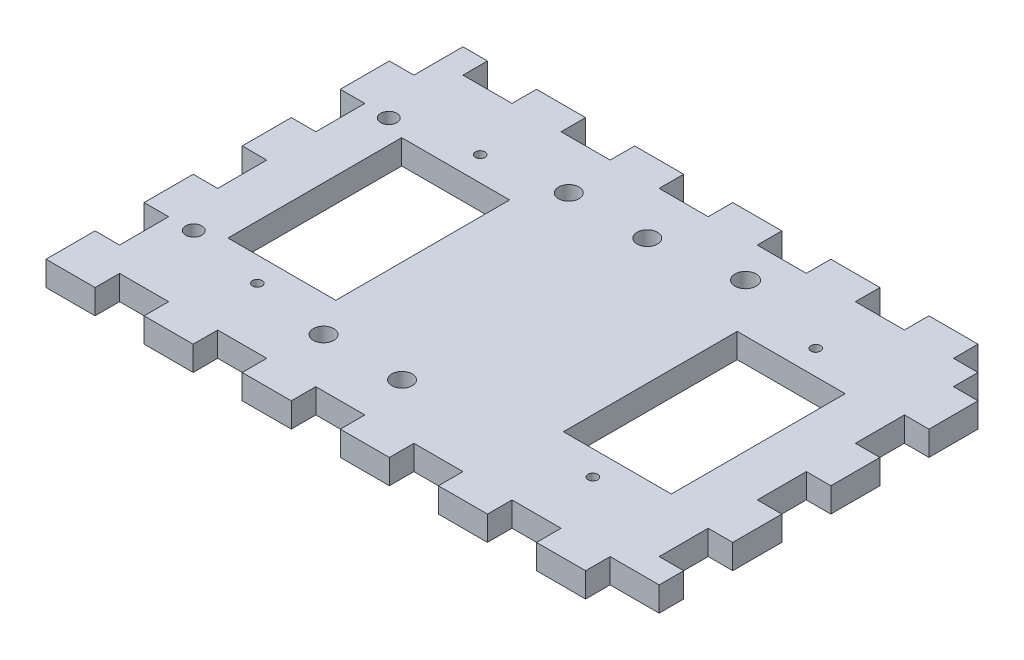
from build123d import *

# Parameters (mm, degrees)
SKETCH1_W                   = 152.4
SKETCH1_H                   = 101.6
BOSS_EXTRUDE2_DEPTH         = 6.35
SKETCH2_W                   = 6.35
SKETCH2_H                   = 12.7
CUT_EXTRUDE2_DEPTH          = 6.35
SKETCH2_4_W                 = 12.7
SKETCH2_4_H                 = 6.35
CUT_EXTRUDE3_DEPTH          = 6.35
SKETCH9_W                   = 27.94
SKETCH9_H                   = 45
CUT_EXTRUDE4_DEPTH          = 184.272045059
TAP_DRILL_FOR_M3X0_5_TAP1_D = 2.5
M5_CLEARANCE_HOLE3_D        = 5.5
TAP_DRILL_FOR_M5X0_8_TAP1_D = 4.2
M5_CLEARANCE_HOLE4_D        = 5.3


with BuildPart() as part:
    # Sketch1 → Boss-Extrude2 (new body)
    with BuildSketch(Plane(origin=(0, 0, 0), x_dir=(1, 0, 0), z_dir=(0, 1, 0))):
        with Locations((76.2, 50.8)):
            Rectangle(SKETCH1_W, SKETCH1_H)
    extrude(amount=BOSS_EXTRUDE2_DEPTH)

    # Sketch2 → Cut-Extrude2 (cut)
    with BuildSketch(Plane(origin=(0, 6.35, 0), x_dir=(1, 0, 0), z_dir=(0, 1, 0))):
        with Locations((3.175, 95.25)):
            Rectangle(SKETCH2_W, SKETCH2_H)
        with Locations((3.175, 69.85)):
            Rectangle(SKETCH2_W, SKETCH2_H)
        with Locations((3.175, 44.45)):
            Rectangle(SKETCH2_W, SKETCH2_H)
        with Locations((3.175, 19.05)):
            Rectangle(SKETCH2_W, SKETCH2_H)
    cut_extrude2 = extrude(amount=-CUT_EXTRUDE2_DEPTH, mode=Mode.SUBTRACT)

    # Mirror1: Cut-Extrude2 across plane
    add(cut_extrude2.mirror(Plane.ZY.offset(-76.2)), mode=Mode.SUBTRACT)

    # Sketch2<4> → Cut-Extrude3 (cut)
    with BuildSketch(Plane(origin=(0, 6.35, 0), x_dir=(1, 0, 0), z_dir=(0, 1, 0))):
        with Locations((19.05, 98.425)):
            Rectangle(SKETCH2_4_W, SKETCH2_4_H)
        with Locations((44.45, 98.425)):
            Rectangle(SKETCH2_4_W, SKETCH2_4_H)
        with Locations((69.85, 98.425)):
            Rectangle(SKETCH2_4_W, SKETCH2_4_H)
        with Locations((95.25, 98.425)):
            Rectangle(SKETCH2_4_W, SKETCH2_4_H)
        with Locations((146.05, 98.425)):
            Rectangle(SKETCH2_4_W, SKETCH2_4_H)
        with Locations((120.65, 98.425)):
            Rectangle(SKETCH2_4_W, SKETCH2_4_H)
    cut_extrude3 = extrude(amount=-CUT_EXTRUDE3_DEPTH, mode=Mode.SUBTRACT)

    # Mirror2: Cut-Extrude3 across plane
    add(cut_extrude3.mirror(Plane(origin=(0, 0, -50.8), x_dir=(1, 0, 0), z_dir=(0, 0, -1))), mode=Mode.SUBTRACT)

    # Sketch9 → Cut-Extrude4 (cut, through all)
    with BuildSketch(Plane(origin=(0, 6.35, 0), x_dir=(1, 0, 0), z_dir=(0, 1, 0))):
        with Locations((32.766, 50.8)):
            Rectangle(SKETCH9_W, SKETCH9_H)
        with Locations((119.634, 50.8)):
            Rectangle(SKETCH9_W, SKETCH9_H)
    extrude(amount=-CUT_EXTRUDE4_DEPTH, mode=Mode.SUBTRACT)

    # Tap Drill for M3x0.5 Tap1 (through all)
    with Locations(Plane(origin=(0, 6.35, 0), x_dir=(1, 0, 0), z_dir=(0, 1, 0))):
        with Locations((32.766, 79.65), (32.766, 21.95), (119.634, 21.95), (119.634, 79.65)):
            Hole(TAP_DRILL_FOR_M3X0_5_TAP1_D / 2)

    # M5 Clearance Hole3 (through all)
    with Locations(Plane(origin=(0, 0, 0), x_dir=(-1, 0, 0), z_dir=(0, -1, 0))):
        with Locations((-95.25, 85.8774)):
            Hole(M5_CLEARANCE_HOLE3_D / 2)

    # Tap Drill for M5x0.8 Tap1 (through all)
    with Locations(Plane(origin=(0, 6.35, 0), x_dir=(1, 0, 0), z_dir=(0, 1, 0))):
        with Locations((12.7, 76.04), (12.7, 25.56)):
            Hole(TAP_DRILL_FOR_M5X0_8_TAP1_D / 2)

    # M5 Clearance Hole4 (through all)
    with Locations(Plane(origin=(0, 0, 0), x_dir=(-1, 0, 0), z_dir=(0, -1, 0))):
        with Locations((-73.126, 82.55), (-52.806, 82.55), (-73.126, 19.05), (-52.806, 19.05)):
            Hole(M5_CLEARANCE_HOLE4_D / 2)


solid = part.part
